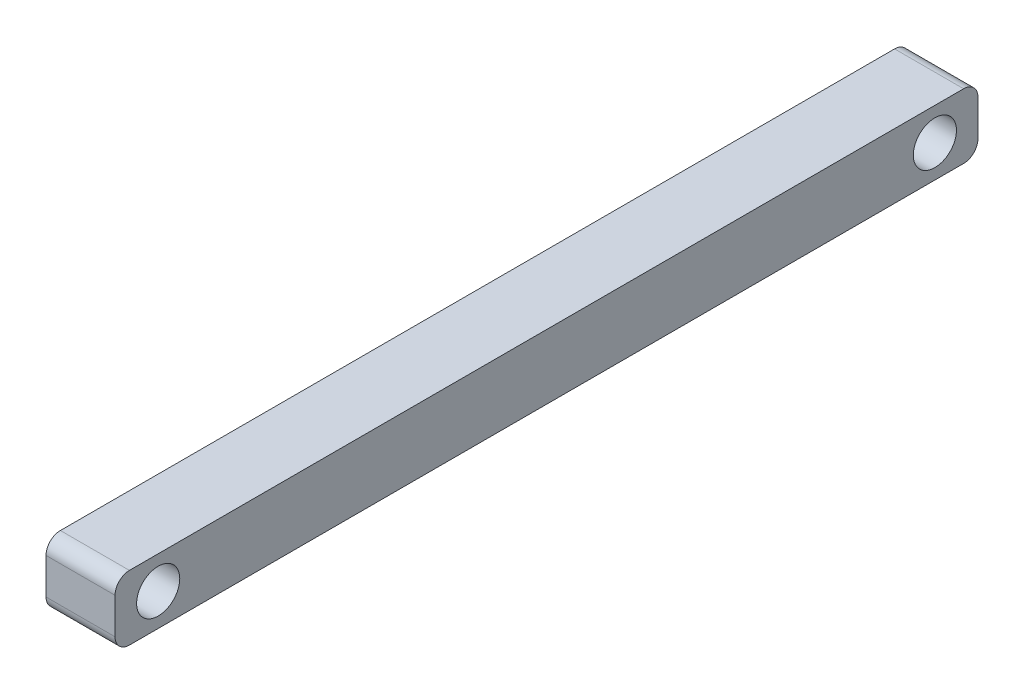
from build123d import *

# Parameters (mm, degrees)
SALIENTE_EXTRUIR1_DEPTH    = 2.4
CORTAR_EXTRUIR1_DEPTH      = 31.179835984
CORTAR_EXTRUIR1_DEPTH_BACK = 31.179835984
CROQUIS2_R                 = 1.5


with BuildPart() as part:
    # Croquis1 → Saliente-Extruir1 (new, symmetric)
    with BuildSketch(Plane(origin=(0, 0, 0), x_dir=(0, 0, -1), z_dir=(1, 0, 0))):
        with BuildLine():
            Line((-29, 2.25), (29, 2.25))
            ThreePointArc((29, 2.25), (29.707106781, 1.957106781), (30, 1.25))
            Line((30, 1.25), (30, -1.25))
            ThreePointArc((30, -1.25), (29.707106781, -1.957106781), (29, -2.25))
            Line((29, -2.25), (-29, -2.25))
            ThreePointArc((-29, -2.25), (-29.707106781, -1.957106781), (-30, -1.25))
            Line((-30, -1.25), (-30, 1.25))
            ThreePointArc((-30, 1.25), (-29.707106781, 1.957106781), (-29, 2.25))
        make_face()
    extrude(amount=SALIENTE_EXTRUIR1_DEPTH, both=True)

    # Croquis2 → Cortar-Extruir1 (cut, two sides: drawn at the far end of the back side and taken through both)
    with BuildSketch(Plane(origin=(0, 0, 0), x_dir=(0, 0, -1), z_dir=(1, 0, 0)).offset(-CORTAR_EXTRUIR1_DEPTH_BACK)):
        with Locations((-27, 0)):
            Circle(CROQUIS2_R)
        with Locations((27, 0)):
            Circle(CROQUIS2_R)
    extrude(amount=CORTAR_EXTRUIR1_DEPTH + CORTAR_EXTRUIR1_DEPTH_BACK, mode=Mode.SUBTRACT)


solid = part.part
